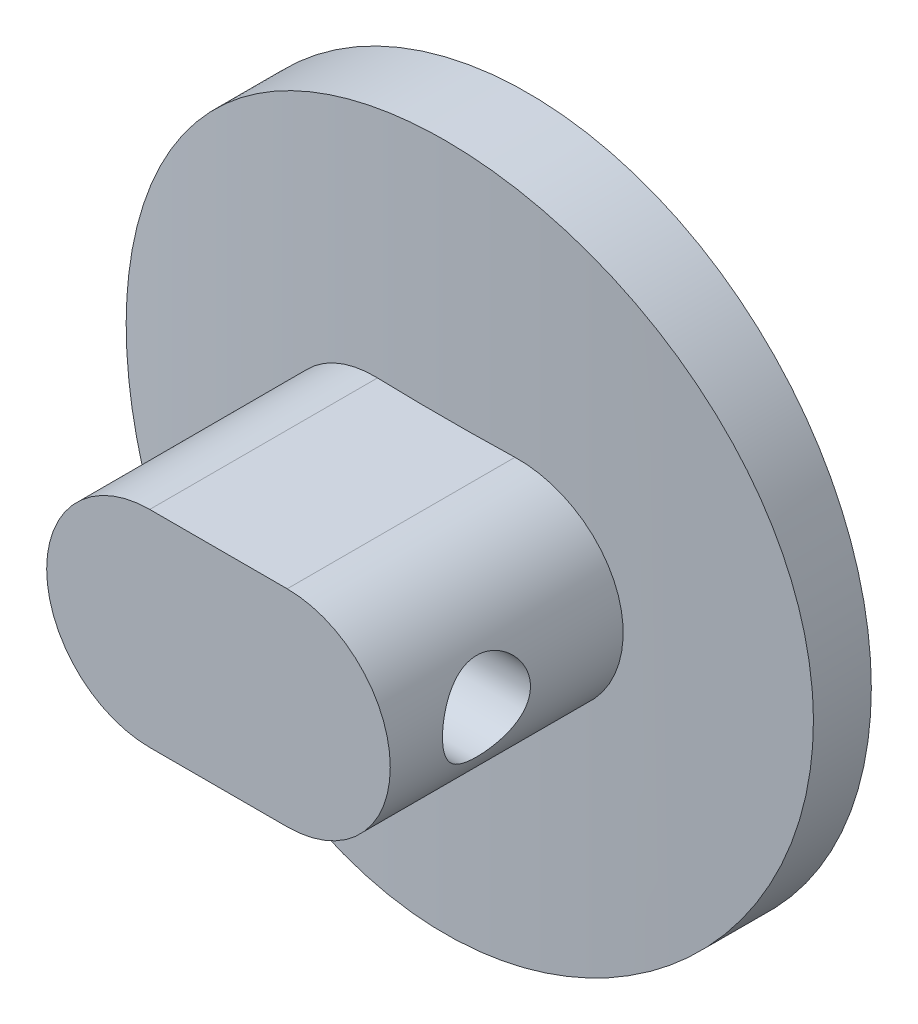
from build123d import *

# Parameters (mm, degrees)
AUFSATZ_LINEAR_START             = -2.5
SKIZZE2_R                        = 25
AUFSATZ_LINEAR_AUSTRAGEN1_DEPTH  = 6
SCHNITT_LINEAR_AUSTRAGEN2_DEPTH  = 476.733381213
AUFSATZ_LINEAR_START_2           = -2.944453
AUFSATZ_LINEAR_AUSTRAGEN5_DEPTH  = 16.944453
SPIEGELN4_START                  = -2.944453335
SPIEGELN4_DEPTH                  = 16.944453335
F_6_4_6_4_DURCHMESSER_BOHRUNG1_D = 6.4


# Read off the part's stored shape, not the designer's step: Spiegeln4
with BuildPart() as part:
    # Skizze2 → Aufsatz-Linear austragen1 (new body)
    with BuildSketch(Plane.XY.offset(AUFSATZ_LINEAR_START)):
        with Locations((450, 0)):
            Circle(SKIZZE2_R)
    extrude(amount=-AUFSATZ_LINEAR_AUSTRAGEN1_DEPTH)

    # Skizze8 → Schnitt-Linear austragen2 (cut, symmetric)
    with BuildSketch(Plane(origin=(0, 0, 0), x_dir=(1, 0, 0), z_dir=(0, 1, 0))):
        with BuildLine():
            Line((450, 2.5), (475, 2.5))
            Line((475, 2.5), (475, 4.284616064))
            ThreePointArc((475, 4.284616064), (462.531808075, 2.946720947), (450, 2.5))
        make_face()
    schnitt_linear_austragen2 = extrude(amount=SCHNITT_LINEAR_AUSTRAGEN2_DEPTH, both=True, mode=Mode.SUBTRACT)

    # Spiegeln1: Schnitt-Linear austragen2 across plane
    add(schnitt_linear_austragen2.mirror(Plane(origin=(450, 0, 0), x_dir=(0, 0, 1), z_dir=(1, 0, 0))), mode=Mode.SUBTRACT)

    # Skizze3 → Aufsatz-Linear austragen5 (add)
    with BuildSketch(Plane.XY.offset(AUFSATZ_LINEAR_START_2)):
        with BuildLine():
            Line((450, 0), (462.5, 0))
            ThreePointArc((462.5, 0), (460.303300859, 5.303300859), (455, 7.5))
            Line((455, 7.5), (450, 7.5))
            Line((450, 7.5), (450, 0))
        make_face()
    extrude(amount=AUFSATZ_LINEAR_AUSTRAGEN5_DEPTH)

    # Spiegeln4 outline → Spiegeln4 (add)
    with BuildSketch(Plane.XY.offset(SPIEGELN4_START)):
        with BuildLine():
            ThreePointArc((455, -7.5), (460.303300859, -5.303300859), (462.5, 0))
            Line((462.5, 0), (450, 0))
            Line((450, 0), (450, 7.5))
            Line((450, 7.5), (445, 7.5))
            ThreePointArc((445, 7.5), (437.5, 0), (445, -7.5))
            Line((445, -7.5), (455, -7.5))
        make_face()
    extrude(amount=SPIEGELN4_DEPTH)

    # Skizze4 → Rotation1 (revolve)
    with BuildSketch(Plane(origin=(450, 0, 0), x_dir=(0, 0, -1), z_dir=(1, 0, 0)), mode=Mode.PRIVATE) as rotation1_sk:
        Polygon((9.5, 7), (8.5, 7), (8.5, 0), (18.5, 0), (18.5, 4), (18.5, 5), (9.5, 5), align=None)
    revolve(rotation1_sk.sketch.rotate(Axis((450, 0, -8.5), (0, 0, -1)), 90), axis=Axis((450, 0, -8.5), (0, 0, -1)))

    # Ø6.4 (6.4) Durchmesser Bohrung1 (through all)
    with Locations(Plane(origin=(462.5, 0, 0), x_dir=(0, 0, -1), z_dir=(1, 0, 0))):
        with Locations((-7, 0)):
            Hole(F_6_4_6_4_DURCHMESSER_BOHRUNG1_D / 2)


solid = part.part
